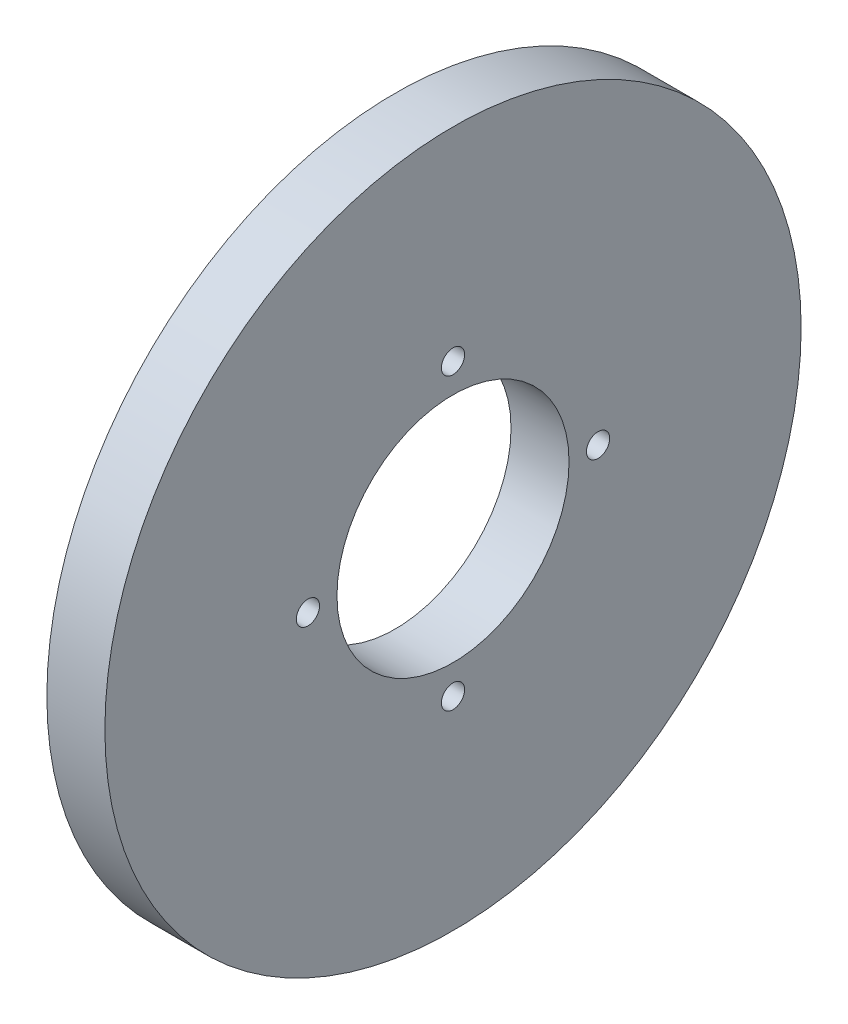
from build123d import *

# Parameters (mm, degrees)
SKETCH1_R           = 60
SKETCH1_R_2         = 20
BOSS_EXTRUDE1_DEPTH = 5
SKETCH2_R           = 2
CUT_EXTRUDE1_DEPTH  = 86.440037453


with BuildPart() as part:
    # Sketch1 → Boss-Extrude1 (new, symmetric)
    with BuildSketch(Plane(origin=(0, 0, 0), x_dir=(0, 0, -1), z_dir=(1, 0, 0))):
        Circle(SKETCH1_R)
        Circle(SKETCH1_R_2, mode=Mode.SUBTRACT)
    extrude(amount=BOSS_EXTRUDE1_DEPTH, both=True)

    # Sketch2 → Cut-Extrude1 (cut, through all)
    with BuildSketch(Plane(origin=(5, 0, 0), x_dir=(0, 0, -1), z_dir=(1, 0, 0))):
        with Locations((0, 25)):
            Circle(SKETCH2_R)
        with Locations((25, 0)):
            Circle(SKETCH2_R)
        with Locations((0, -25)):
            Circle(SKETCH2_R)
        with Locations((-25, 0)):
            Circle(SKETCH2_R)
    extrude(amount=-CUT_EXTRUDE1_DEPTH, mode=Mode.SUBTRACT)


solid = part.part
